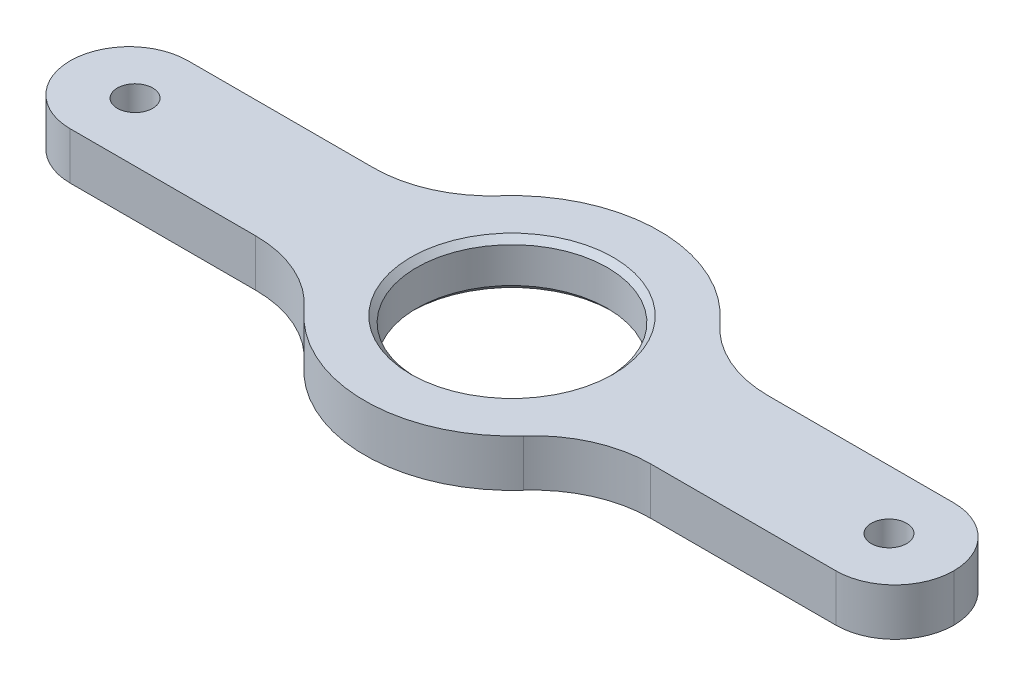
from build123d import *

# Parameters (mm, degrees)
SKETCH1_W           = 75
SKETCH1_H           = 10
BOSS_EXTRUDE1_DEPTH = 4
SKETCH7_R           = 12.5
BOSS_EXTRUDE2_DEPTH = 4
SKETCH4_R           = 8.1
CUT_EXTRUDE3_DEPTH  = 40.730341051
FILLET2_R           = 10
SKETCH8_R           = 1.5
CUT_EXTRUDE4_DEPTH  = 40.730341051
FILLET3_R           = 5
CHAMFER1_SIZE       = 0.5


with BuildPart() as part:
    # Sketch1 → Boss-Extrude1 (new body)
    with BuildSketch(Plane(origin=(0, 0, 0), x_dir=(1, 0, 0), z_dir=(0, 1, 0))):
        Rectangle(SKETCH1_W, SKETCH1_H)
    extrude(amount=BOSS_EXTRUDE1_DEPTH)

    # Sketch7 → Boss-Extrude2 (add)
    with BuildSketch(Plane(origin=(0, 4, 0), x_dir=(1, 0, 0), z_dir=(0, 1, 0))):
        Circle(SKETCH7_R)
    extrude(amount=-BOSS_EXTRUDE2_DEPTH)

    # Sketch4 → Cut-Extrude3 (cut, through all)
    with BuildSketch(Plane(origin=(0, 4, 0), x_dir=(1, 0, 0), z_dir=(0, 1, 0))):
        with Locations(Location((0, 0, 0), (0, 0, 270))):
            Circle(SKETCH4_R)
    extrude(amount=-CUT_EXTRUDE3_DEPTH, mode=Mode.SUBTRACT)

    # Fillet2
    fillet2_edges = [part.edges().sort_by_distance(p)[0] for p in [
        (11.456439237, 2, -5),
        (11.456439237, 2, 5),
        (-11.456439237, 2, -5),
        (-11.456439237, 2, 5),
    ]]
    fillet(fillet2_edges, radius=FILLET2_R)

    # Sketch8 → Cut-Extrude4 (cut, through all)
    with BuildSketch(Plane(origin=(0, 4, 0), x_dir=(1, 0, 0), z_dir=(0, 1, 0))):
        with Locations(Location((-32, 0, 0), (0, 0, 270))):
            Circle(SKETCH8_R)
    cut_extrude4 = extrude(amount=-CUT_EXTRUDE4_DEPTH, mode=Mode.SUBTRACT)

    # Mirror2: Cut-Extrude4 across plane
    add(cut_extrude4.mirror(Plane(origin=(0, 0, 0), x_dir=(0, 0, 1), z_dir=(1, 0, 0))), mode=Mode.SUBTRACT)

    # Fillet3
    fillet3_edges = [part.edges().sort_by_distance(p)[0] for p in [
        (-37.5, 2, -5),
        (-37.5, 2, 5),
        (37.5, 2, 5),
        (37.5, 2, -5),
    ]]
    fillet(fillet3_edges, radius=FILLET3_R - 0.0001)  # a hair under: the kernel refuses the full size

    # Chamfer1
    chamfer1_edges = [part.edges().sort_by_distance(p)[0] for p in [
        (0, 0, -8.1),
        (0, 4, -8.1),
    ]]
    chamfer(chamfer1_edges, length=CHAMFER1_SIZE)


solid = part.part
